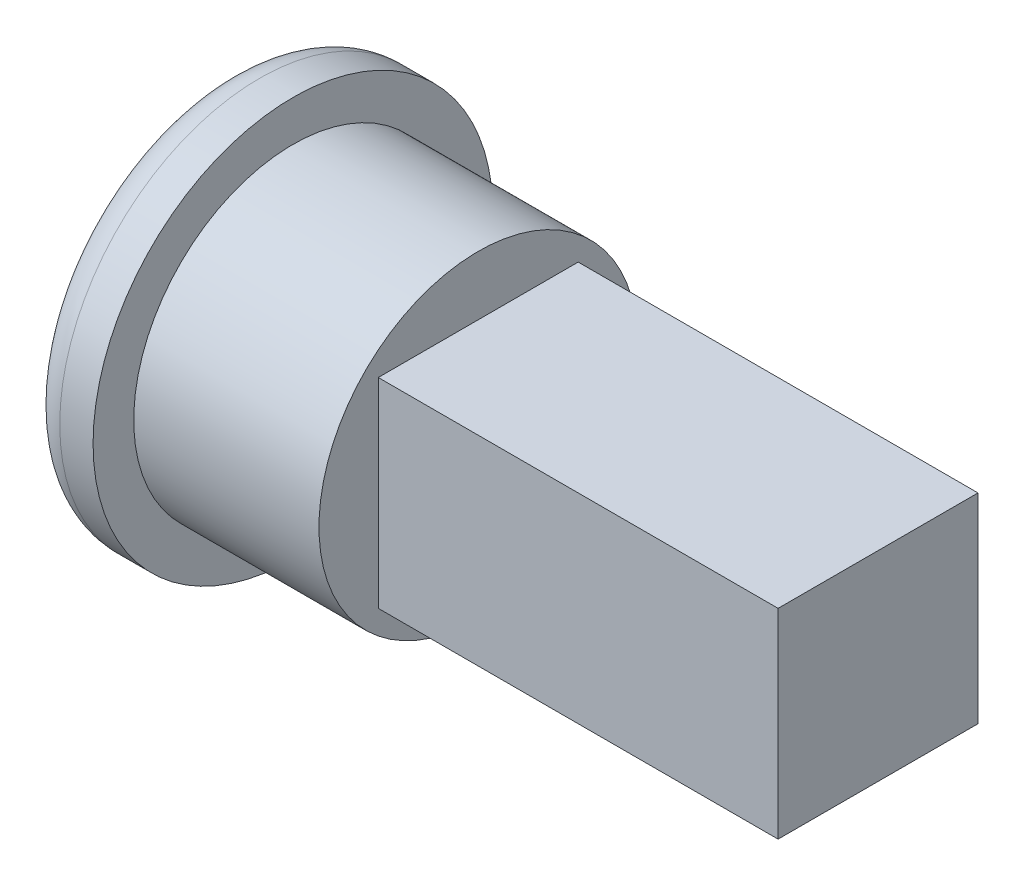
from build123d import *

# Parameters (mm, degrees)
SKETCH1_R           = 4.78
BOSS_EXTRUDE1_DEPTH = 2.78
SKETCH2_W           = 6
SKETCH2_H           = 6
BOSS_EXTRUDE2_DEPTH = 12
SKETCH3_R           = 6
BOSS_EXTRUDE3_DEPTH = 2
FILLET1_R           = 1


with BuildPart() as part:
    # Sketch1 → Boss-Extrude1 (new, symmetric)
    with BuildSketch(Plane(origin=(0, 0, 0), x_dir=(0, 0, -1), z_dir=(1, 0, 0))):
        Circle(SKETCH1_R)
    extrude(amount=BOSS_EXTRUDE1_DEPTH, both=True)

    # Sketch2 → Boss-Extrude2 (add)
    with BuildSketch(Plane(origin=(2.78, 0, 0), x_dir=(0, 0, -1), z_dir=(1, 0, 0))):
        Rectangle(SKETCH2_W, SKETCH2_H)
    extrude(amount=BOSS_EXTRUDE2_DEPTH)

    # Sketch3 → Boss-Extrude3 (add)
    with BuildSketch(Plane.ZY.offset(2.78)):
        Circle(SKETCH3_R)
    extrude(amount=BOSS_EXTRUDE3_DEPTH)

    # Fillet1
    fillet1_edges = [part.edges().sort_by_distance(p)[0] for p in [
        (-4.78, 0, -6),
    ]]
    fillet(fillet1_edges, radius=FILLET1_R)


solid = part.part
